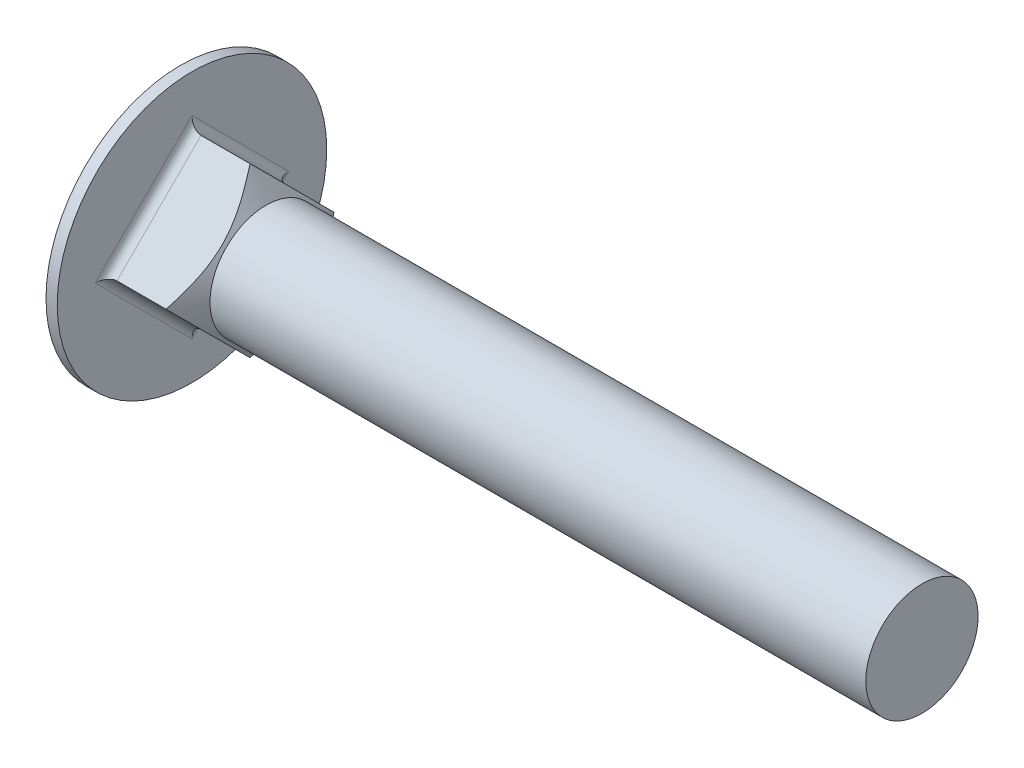
from build123d import *

# Parameters (mm, degrees)
NECK_DEPTH   = 6.6
HEADFILLET_R = 0.8


with BuildPart() as part:
    # Sketch1 → BaseHead (revolve)
    with BuildSketch(Plane.XY):
        with BuildLine():
            Line((4, 12), (5, 12))
            Line((5, 12), (5, 0))
            Line((5, 0), (0, 0))
            ThreePointArc((0, 0), (1.026334039, 6.32455532), (4, 12))
        make_face()
    revolve(axis=Axis((-9.828175901, 0, 0), (1, 0, 0)))

    # Sketch2 → Neck (add)
    with BuildSketch(Plane(origin=(5, 0, 0), x_dir=(0, 0, -1), z_dir=(1, 0, 0))):
        Polygon((-7.481189745, 0), (0, -7.481189745), (7.481189745, 0), (0, 7.481189745), align=None)
    extrude(amount=NECK_DEPTH)

    # Sketch3 → Cut-Revolve1 (revolve, cut)
    with BuildSketch(Plane.XY):
        Polygon((11.6, 7.481189745), (10.167484433, 7.481189745), (11.6, 5), align=None)
    revolve(axis=Axis((5, 0, 0), (1, 0, 0)), mode=Mode.SUBTRACT)

    # HeadFillet
    headfillet_edges = [part.edges().sort_by_distance(p)[0] for p in [
        (5, 3.740594872, -3.740594872),
        (5, -3.740594872, -3.740594872),
        (5, -3.740594872, 3.740594872),
        (5, 3.740594872, 3.740594872),
    ]]
    fillet(headfillet_edges, radius=HEADFILLET_R)

    # Sketch4 → Revolve1 (revolve)
    with BuildSketch(Plane(origin=(0, 0, 0), x_dir=(1, 0, 0), z_dir=(0, 1, 0))):
        Polygon((70, 5), (44, 5), (11.6, 5), (11.6, 0), (70, 0), align=None)
    revolve(axis=Axis((-12.285447011, 0, 0), (1, 0, 0)))


solid = part.part
